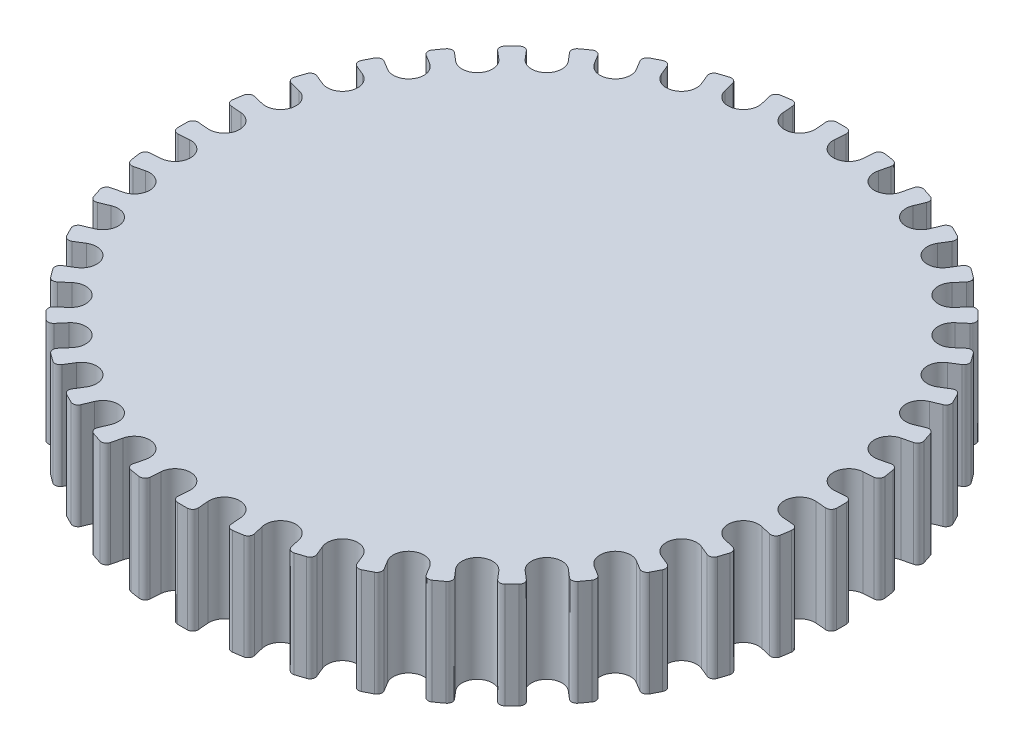
from build123d import *

# Parameters (mm, degrees)
BOSS_EXTRUDE1_DEPTH      = 5
CUT_EXTRUDE1_START       = -5
CUT_EXTRUDE1_DEPTH       = 10
FILLET1_R                = 0.5
CIRPATTERN1_COUNT        = 40
FILLET1_OF_CIRPATTERN1_R = 0.5


# Read off the part's stored shape, not the designer's step: Cut-Extrude1
with BuildPart() as part:
    # Sketch5 → Boss-Extrude1 (new, symmetric)
    with BuildSketch(Plane(origin=(0, 0, 0), x_dir=(1, 0, 0), z_dir=(0, 1, 0))):
        with BuildLine():
            ThreePointArc((-1.002182596, 31.214904775), (-2.450355126, 31.134713903), (-3.893242864, 30.987373398))
            Line((-3.893242864, 30.987373398), (-3.774273661, 29.475726347))
            ThreePointArc((-3.774273661, 29.475726347), (-2.214977839, 28.143961902), (-0.883213393, 29.703257725))
            Line((-0.883213393, 29.703257725), (-1.002182596, 31.214904775))
        make_face()
        with BuildLine():
            Line((-3.774273661, 29.475726347), (-3.893242864, 30.987373398))
            ThreePointArc((-3.893242864, 30.987373398), (-20.661374912, -23.419697625), (31.230988618, 0))
            ThreePointArc((31.230988618, 0), (21.726429721, 22.435171086), (-1.002182596, 31.214904775))
            Line((-1.002182596, 31.214904775), (-0.883213393, 29.703257725))
            ThreePointArc((-0.883213393, 29.703257725), (-2.214977839, 28.143961902), (-3.774273661, 29.475726347))
        make_face()
    extrude(amount=BOSS_EXTRUDE1_DEPTH, both=True)

    # Cut-Extrude1 outline → Cut-Extrude1 (cut)
    with BuildSketch(Plane(origin=(0, 0, 0), x_dir=(1, 0, 0), z_dir=(0, 1, 0)).offset(CUT_EXTRUDE1_START)):
        with BuildLine():
            ThreePointArc((-1.002182596, 31.214904775), (-2.450355125, 31.134713903), (-3.893242864, 30.987373397))
            Line((-3.893242864, 30.987373397), (-3.774273661, 29.475726347))
            ThreePointArc((-3.774273661, 29.475726347), (-2.214977838, 28.143961902), (-0.883213393, 29.703257725))
            Line((-0.883213393, 29.703257725), (-1.002182596, 31.214904775))
        make_face()
    cut_extrude1 = extrude(amount=CUT_EXTRUDE1_DEPTH, mode=Mode.SUBTRACT)

    # Fillet1
    fillet1_edges = [part.edges().sort_by_distance(p)[0] for p in [
        (-3.893242864, 0, -30.987373397),
        (-1.002182596, 0, -31.214904775),
    ]]
    fillet(fillet1_edges, radius=FILLET1_R)

    # CirPattern1: Cut-Extrude1 ×40 about axis
    cirpattern1_axis = Axis((0, 0, 0), (0, 1, 0))
    for i in range(1, CIRPATTERN1_COUNT):
        add(cut_extrude1.rotate(cirpattern1_axis, i * 360 / CIRPATTERN1_COUNT), mode=Mode.SUBTRACT)

    # Fillet1 of CirPattern1
    fillet1_of_cirpattern1_edges = [part.edges().sort_by_distance(p)[0] for p in [
        (-8.692803764, 0, -29.996830045),
        (-5.872930995, 0, -30.673821601),
        (-13.278318986, 0, -28.267665184),
        (-10.599068342, 0, -29.377447138),
        (-17.536877926, 0, -25.842456591),
        (-15.06422145, 0, -27.357702429),
        (-21.36362073, 0, -22.78092095),
        (-19.15844343, 0, -24.664320291),
        (-24.66432029, 0, -19.15844343),
        (-22.78092095, 0, -21.363620731),
        (-27.357702428, 0, -15.06422145),
        (-25.842456591, 0, -17.536877927),
        (-29.377447138, 0, -10.599068342),
        (-28.267665184, 0, -13.278318987),
        (-30.6738216, 0, -5.872930995),
        (-29.996830045, 0, -8.692803765),
        (-31.214904775, 0, -1.002182596),
        (-30.987373397, 0, -3.893242865),
        (-30.987373397, 0, 3.893242864),
        (-31.214904775, 0, 1.002182596),
        (-29.996830045, 0, 8.692803764),
        (-30.673821601, 0, 5.872930995),
        (-28.267665184, 0, 13.278318986),
        (-29.377447138, 0, 10.599068342),
        (-25.842456591, 0, 17.536877926),
        (-27.357702429, 0, 15.06422145),
        (-22.78092095, 0, 21.36362073),
        (-24.664320291, 0, 19.15844343),
        (-19.15844343, 0, 24.66432029),
        (-21.363620731, 0, 22.78092095),
        (-15.06422145, 0, 27.357702428),
        (-17.536877927, 0, 25.842456591),
        (-10.599068342, 0, 29.377447138),
        (-13.278318987, 0, 28.267665184),
        (-5.872930995, 0, 30.6738216),
        (-8.692803765, 0, 29.996830045),
        (-1.002182596, 0, 31.214904775),
        (-3.893242865, 0, 30.987373397),
        (3.893242864, 0, 30.987373397),
        (1.002182596, 0, 31.214904775),
        (8.692803764, 0, 29.996830045),
        (5.872930995, 0, 30.673821601),
        (13.278318986, 0, 28.267665184),
        (10.599068342, 0, 29.377447138),
        (17.536877926, 0, 25.842456591),
        (15.06422145, 0, 27.357702429),
        (21.36362073, 0, 22.78092095),
        (19.15844343, 0, 24.664320291),
        (24.66432029, 0, 19.15844343),
        (22.78092095, 0, 21.363620731),
        (27.357702428, 0, 15.06422145),
        (25.842456591, 0, 17.536877927),
        (29.377447138, 0, 10.599068342),
        (28.267665184, 0, 13.278318987),
        (30.6738216, 0, 5.872930995),
        (29.996830045, 0, 8.692803765),
        (31.214904775, 0, 1.002182596),
        (30.987373397, 0, 3.893242865),
        (30.987373397, 0, -3.893242864),
        (31.214904775, 0, -1.002182596),
        (29.996830045, 0, -8.692803764),
        (30.673821601, 0, -5.872930995),
        (28.267665184, 0, -13.278318986),
        (29.377447138, 0, -10.599068342),
        (25.842456591, 0, -17.536877926),
        (27.357702429, 0, -15.06422145),
        (22.78092095, 0, -21.36362073),
        (24.664320291, 0, -19.15844343),
        (19.15844343, 0, -24.66432029),
        (21.363620731, 0, -22.78092095),
        (15.06422145, 0, -27.357702428),
        (17.536877927, 0, -25.842456591),
        (10.599068342, 0, -29.377447138),
        (13.278318987, 0, -28.267665184),
        (5.872930995, 0, -30.6738216),
        (8.692803765, 0, -29.996830045),
        (1.002182596, 0, -31.214904775),
        (3.893242865, 0, -30.987373397),
    ]]
    fillet(fillet1_of_cirpattern1_edges, radius=FILLET1_OF_CIRPATTERN1_R)


solid = part.part
